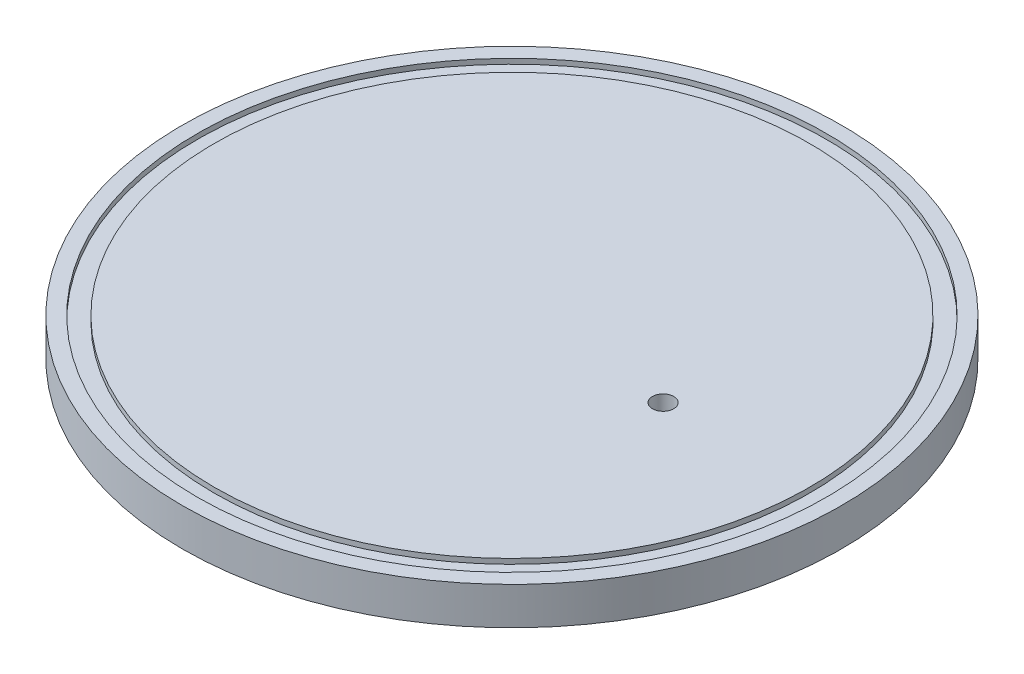
from build123d import *

# Parameters (mm, degrees)
SKETCH_1_R               = 38.598396019
EXTRUDE_1_DEPTH          = 4.4
SKETCH_2_R               = 36.869922329
SKETCH_2_R_2             = 34.869922329
CUT_EXTRUDE_1_DEPTH      = 0.6
SKETCH_3_W               = 5
SKETCH_3_H               = 9
EXTRUDE_2_DEPTH          = 14.5
FILLET_2_R               = 4.5
CUT_EXTRUDE_2_DEPTH      = 59.216529702
CUT_EXTRUDE_2_DEPTH_BACK = 59.216529702
SKETCH_4_R               = 1.55
CUT_EXTRUDE_3_DEPTH      = 57.479397575
CUT_EXTRUDE_3_DEPTH_BACK = 57.479397575
SKETCH_5_R               = 1.25


with BuildPart() as part:
    # 스케치1 → 보스-돌출1 (new body)
    with BuildSketch(Plane(origin=(0, 0, 0), x_dir=(1, 0, 0), z_dir=(0, 1, 0))):
        with Locations(Location((0, 0, 0), (0, 0, 270))):
            Circle(SKETCH_1_R)
    extrude(amount=EXTRUDE_1_DEPTH)

    # 스케치2 → 컷-돌출1 (cut)
    with BuildSketch(Plane(origin=(0, 4.4, 0), x_dir=(1, 0, 0), z_dir=(0, 1, 0))):
        with Locations(Location((0, 0, 0), (0, 0, 270))):
            Circle(SKETCH_2_R)
        with Locations(Location((0, 0, 0), (0, 0, 270))):
            Circle(SKETCH_2_R_2, mode=Mode.SUBTRACT)
    extrude(amount=-CUT_EXTRUDE_1_DEPTH, mode=Mode.SUBTRACT)

    # 스케치3 → 보스-돌출2 (add)
    with BuildSketch(Plane.XZ):
        with Locations((0, -15)):
            Rectangle(SKETCH_3_W, SKETCH_3_H)
        with Locations((0, 15)):
            Rectangle(SKETCH_3_W, SKETCH_3_H)
    extrude(amount=EXTRUDE_2_DEPTH)

    # 필렛2
    fillet_2_edges = [part.edges().sort_by_distance(p)[0] for p in [
        (0, -14.5, -19.5),
        (0, -14.5, -10.5),
        (0, -14.5, 19.5),
        (0, -14.5, 10.5),
    ]]
    fillet(fillet_2_edges, radius=FILLET_2_R - 0.0001)  # a hair under: the kernel refuses the full size

    # 스케치4 → 컷-돌출2 (cut, two sides: drawn at the far end of the back side and taken through both)
    with BuildSketch(Plane.ZY.offset(2.5).offset(-CUT_EXTRUDE_2_DEPTH_BACK)):
        with Locations((-15, -10)):
            Circle(SKETCH_4_R)
        with Locations((15, -10)):
            Circle(SKETCH_4_R)
    extrude(amount=CUT_EXTRUDE_2_DEPTH + CUT_EXTRUDE_2_DEPTH_BACK, mode=Mode.SUBTRACT)

    # 스케치5 → 컷-돌출3 (cut, two sides: drawn at the far end of the back side and taken through both)
    with BuildSketch(Plane.XZ.offset(-CUT_EXTRUDE_3_DEPTH_BACK)):
        with Locations(Location((17.7, 0, 0), (0, 0, 270))):
            Circle(SKETCH_5_R)
    extrude(amount=CUT_EXTRUDE_3_DEPTH + CUT_EXTRUDE_3_DEPTH_BACK, mode=Mode.SUBTRACT)


solid = part.part
